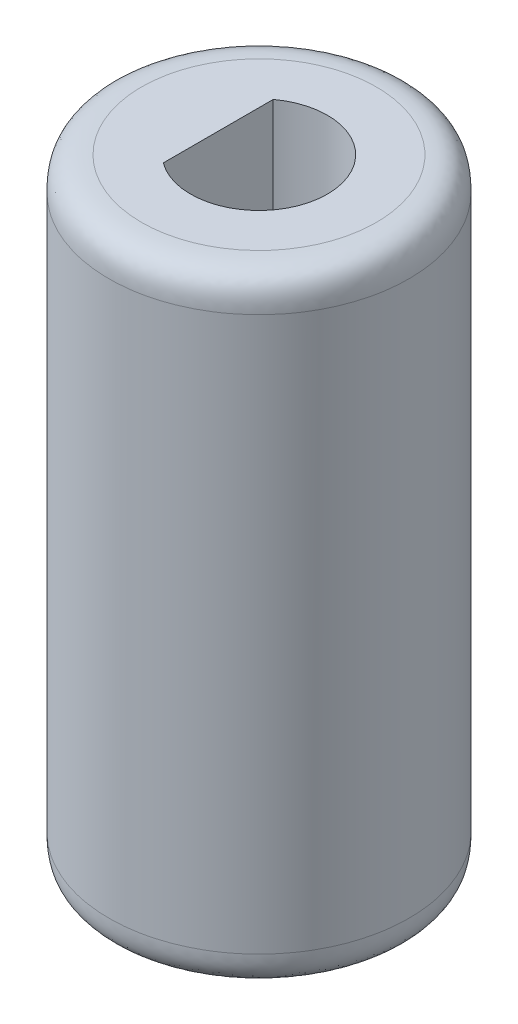
from build123d import *

# Parameters (mm, degrees)
BOSS_EXTRUDE1_START = 18
BOSS_EXTRUDE1_DEPTH = 18
BOSS_EXTRUDE2_DEPTH = 18
FILLET1_SIZE        = 2


with BuildPart() as part:
    # Sketch1 → Revolve1 (revolve)
    with BuildSketch(Plane.XY):
        Polygon((-9.207, 38), (-9.207, 0), (-5.207, 0), (-5.207, 18), (0, 18), (0, 20), (-4.2, 20), (-4.2, 38), align=None)
    revolve(axis=Axis((0, 38, 0), (0, -1, 0)))

    # Sketch3 → Boss-Extrude1 (add)
    with BuildSketch(Plane(origin=(0, 20, 0), x_dir=(1, 0, 0), z_dir=(0, 1, 0)).offset(BOSS_EXTRUDE1_START)):
        with BuildLine():
            Line((-2.5, 3.374907406), (-2.5, -3.374907406))
            ThreePointArc((-2.5, -3.374907406), (-4.2, 0), (-2.5, 3.374907406))
        make_face()
    extrude(amount=-BOSS_EXTRUDE1_DEPTH)

    # Sketch2 → Boss-Extrude2 (add)
    with BuildSketch(Plane.XZ.offset(-18)):
        with BuildLine():
            ThreePointArc((5.207, 0), (4.946482892, 1.626393556), (4.191, 3.090043365))
            Line((4.191, 3.090043365), (4.191, -3.090043365))
            ThreePointArc((4.191, -3.090043365), (4.946482892, -1.626393556), (5.207, 0))
        make_face()
    extrude(amount=BOSS_EXTRUDE2_DEPTH)

    # Fillet1
    # a fillet whose section is not a circle: 2 mm, written as the material it takes off along each edge
    with BuildSketch(Plane(origin=(0, 0, 0), x_dir=(-1, 0, 0), z_dir=(0, 0, 1))) as fillet1_piece_1:
        with BuildLine():
            add(Edge.make_bspline([(9.207, -FILLET1_SIZE), (9.207, -FILLET1_SIZE * 0.831801948466), (9.207, -FILLET1_SIZE * 0.663603896932), (9.207 - FILLET1_SIZE * 0.0716919198361, -FILLET1_SIZE * 0.292893218813), (9.207 - FILLET1_SIZE * 0.292893218813, -FILLET1_SIZE * 0.0716919198361), (9.207 - FILLET1_SIZE * 0.663603896932, 0), (9.207 - FILLET1_SIZE * 0.831801948466, 0), (9.207 - FILLET1_SIZE, 0)], knots=[0, 0, 0, 0, 0, 0, 0.5, 0.5, 1, 1, 1, 1, 1, 1], degree=5))
            Line((9.207 - FILLET1_SIZE, 0), (9.207, 0))
            Line((9.207, 0), (9.207, -FILLET1_SIZE))
        make_face()
    revolve(axis=Axis((0, 0, 0), (0, -1, 0)), mode=Mode.SUBTRACT)
    with BuildSketch(Plane(origin=(0, 38, 0), x_dir=(-1, 0, 0), z_dir=(0, 0, 1))) as fillet1_piece_2:
        with BuildLine():
            add(Edge.make_bspline([(9.207, FILLET1_SIZE), (9.207, FILLET1_SIZE * 0.831801948466), (9.207, FILLET1_SIZE * 0.663603896932), (9.207 - FILLET1_SIZE * 0.0716919198361, FILLET1_SIZE * 0.292893218813), (9.207 - FILLET1_SIZE * 0.292893218813, FILLET1_SIZE * 0.0716919198361), (9.207 - FILLET1_SIZE * 0.663603896932, 0), (9.207 - FILLET1_SIZE * 0.831801948466, 0), (9.207 - FILLET1_SIZE, 0)], knots=[0, 0, 0, 0, 0, 0, 0.5, 0.5, 1, 1, 1, 1, 1, 1], degree=5))
            Line((9.207 - FILLET1_SIZE, 0), (9.207, 0))
            Line((9.207, 0), (9.207, FILLET1_SIZE))
        make_face()
    revolve(axis=Axis((0, 38, 0), (0, -1, 0)), mode=Mode.SUBTRACT)


solid = part.part
